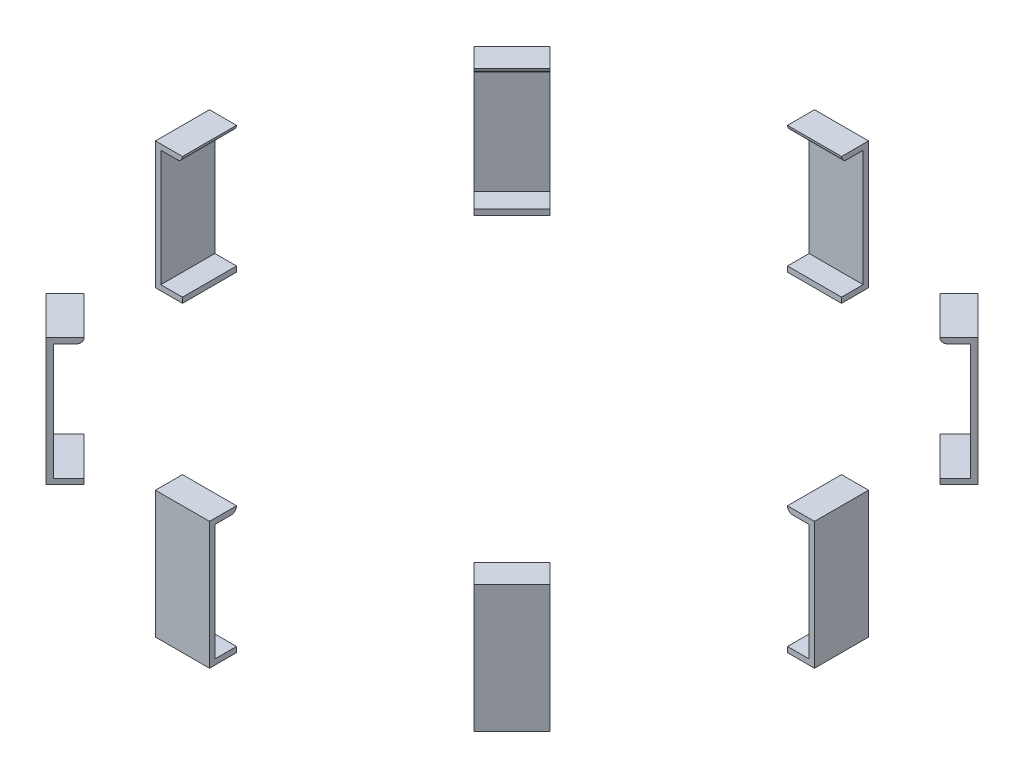
from build123d import *

# Parameters (mm, degrees)
SKETCH1_W           = 10
SKETCH1_H           = 5
BOSS_EXTRUDE1_DEPTH = 1
SKETCH2_W           = 10
SKETCH2_H           = 1
BOSS_EXTRUDE2_DEPTH = 22.55
SKETCH3_W           = 10
SKETCH3_H           = 1
BOSS_EXTRUDE3_DEPTH = 4
FILLET1_R           = 1
CIRPATTERN1_COUNT   = 8


with BuildPart() as part:
    # Sketch1 → Boss-Extrude1 (new body)
    with BuildSketch(Plane(origin=(0, 0, 0), x_dir=(1, 0, 0), z_dir=(0, 1, 0))):
        with Locations((0, 58.5)):
            Rectangle(SKETCH1_W, SKETCH1_H)
    extrude(amount=BOSS_EXTRUDE1_DEPTH)

    # Sketch2 → Boss-Extrude2 (add)
    with BuildSketch(Plane(origin=(0, 1, 0), x_dir=(1, 0, 0), z_dir=(0, 1, 0))):
        with Locations((0, 60.5)):
            Rectangle(SKETCH2_W, SKETCH2_H)
    extrude(amount=BOSS_EXTRUDE2_DEPTH)

    # Sketch3 → Boss-Extrude3 (add)
    with BuildSketch(Plane.XY.offset(-60)):
        with Locations((0, 23.05)):
            Rectangle(SKETCH3_W, SKETCH3_H)
    extrude(amount=BOSS_EXTRUDE3_DEPTH)

    # Fillet1
    fillet1_edges = [part.edges().sort_by_distance(p)[0] for p in [
        (0, 22.55, -56),
    ]]
    fillet(fillet1_edges, radius=FILLET1_R - 0.0001)  # a hair under: the kernel refuses the full size


with BuildPart() as cirpattern1_1:
    # CirPattern1: pattern copy
    add(part.part.rotate(Axis((0, 0, 0), (0, 1, 0)), 1 * 360 / CIRPATTERN1_COUNT))


with BuildPart() as cirpattern1_2:
    # CirPattern1: pattern copy
    add(part.part.rotate(Axis((0, 0, 0), (0, 1, 0)), 2 * 360 / CIRPATTERN1_COUNT))


with BuildPart() as cirpattern1_3:
    # CirPattern1: pattern copy
    add(part.part.rotate(Axis((0, 0, 0), (0, 1, 0)), 3 * 360 / CIRPATTERN1_COUNT))


with BuildPart() as cirpattern1_4:
    # CirPattern1: pattern copy
    add(part.part.rotate(Axis((0, 0, 0), (0, 1, 0)), 4 * 360 / CIRPATTERN1_COUNT))


with BuildPart() as cirpattern1_5:
    # CirPattern1: pattern copy
    add(part.part.rotate(Axis((0, 0, 0), (0, 1, 0)), 5 * 360 / CIRPATTERN1_COUNT))


with BuildPart() as cirpattern1_6:
    # CirPattern1: pattern copy
    add(part.part.rotate(Axis((0, 0, 0), (0, 1, 0)), 6 * 360 / CIRPATTERN1_COUNT))


with BuildPart() as cirpattern1_7:
    # CirPattern1: pattern copy
    add(part.part.rotate(Axis((0, 0, 0), (0, 1, 0)), 7 * 360 / CIRPATTERN1_COUNT))


solid = Compound([part.part, cirpattern1_1.part, cirpattern1_2.part, cirpattern1_3.part, cirpattern1_4.part, cirpattern1_5.part, cirpattern1_6.part, cirpattern1_7.part])
